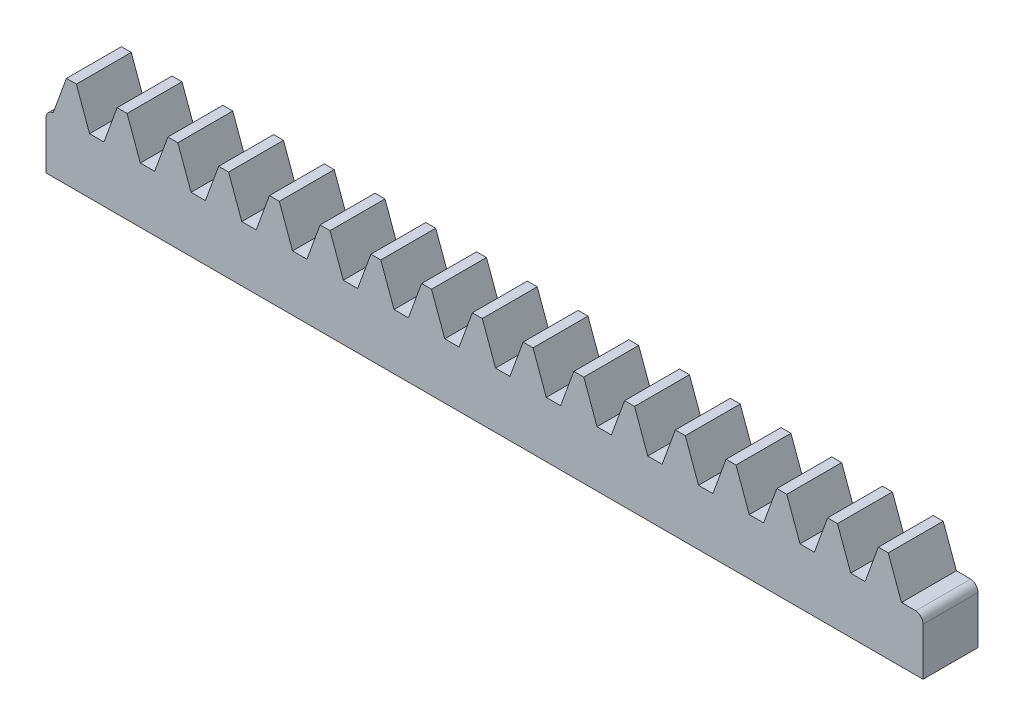
from build123d import *

# Parameters (mm, degrees)
BLANKSKE_W        = 54.3
BLANKSKE_H        = 5.7
BLANK_DEPTH       = 3.4
TOOTHCUTSIM_DEPTH = 55.704113191
TEETHCUTS_COUNT   = 18
TEETHCUTS_PITCH   = 3.14159265
VERRUNDUNG1_R     = 0.5
VERRUNDUNG2_R     = 0.5
SCALE1_SCALE      = 1.46


with BuildPart() as part:
    # BlankSke → Blank (new body)
    with BuildSketch(Plane.XY):
        with Locations((27.15, 2.85)):
            Rectangle(BLANKSKE_W, BLANKSKE_H)
    extrude(amount=-BLANK_DEPTH)

    # TooCutSkeSim → ToothCutSim (cut, through all)
    with BuildSketch(Plane.XY):
        Polygon((0.44443537, 3.45), (-0.44443537, 3.45), (-1.272613241, 5.7254), (1.272613241, 5.7254), align=None)
    toothcutsim = extrude(amount=-TOOTHCUTSIM_DEPTH, mode=Mode.SUBTRACT)

    # TeethCuts: ToothCutSim ×18
    with Locations(*[(i * TEETHCUTS_PITCH, 0, 0) for i in range(1, TEETHCUTS_COUNT)]):
        add(toothcutsim, mode=Mode.SUBTRACT)

    # Verrundung1
    # the kernel refuses this fillet: 0.5 mm, written as the material it takes off along each edge
    with BuildSketch(Plane(origin=(54.3, 4.682214995, -7.723886484), x_dir=(0, -1, 0), z_dir=(0, 0, 1))) as verrundung1_piece_1:
        with BuildLine():
            CenterArc((1.729554594, -0.5), VERRUNDUNG1_R, 90, 84.086849411)
            Line((1.232214995, -0.44848958), (1.222268203, -0.447459372))
            ThreePointArc((1.222268203, -0.447459372), (0.612687296, -0.233641716), (-0.003420201, -0.009396926))
            Line((-0.003420201, -0.009396926), (0, 0.01))
            Line((0, 0.01), (1.729554594, 0.01))
            Line((1.729554594, 0.01), (1.729554594, 0))
        make_face()
    extrude(amount=12.047772969, mode=Mode.SUBTRACT)

    # Verrundung2
    # the kernel refuses this fillet: 0.5 mm, written as the material it takes off along each edge
    with BuildSketch(Plane(origin=(0, 3.45, 1.242257451), x_dir=(0, -1, 0), z_dir=(0, 0, -1))) as verrundung2_piece_1:
        with BuildLine():
            CenterArc((0.49690298, -0.5), VERRUNDUNG2_R, 90, 83.619583418)
            Line((0, -0.44443537), (-0.00993806, -0.443324077))
            ThreePointArc((-0.00993806, -0.443324077), (-0.01, -0.222217685), (-0.01, 0))
            Line((-0.01, 0), (0, 0.01))
            Line((0, 0.01), (0.49690298, 0.01))
            Line((0.49690298, 0.01), (0.49690298, 0))
        make_face()
    extrude(amount=5.884514902, mode=Mode.SUBTRACT)


with BuildPart() as part_1:
    # Scale1: scaled about (0, 0, 0)
    add(part.part.scale(SCALE1_SCALE))


solid = part_1.part
